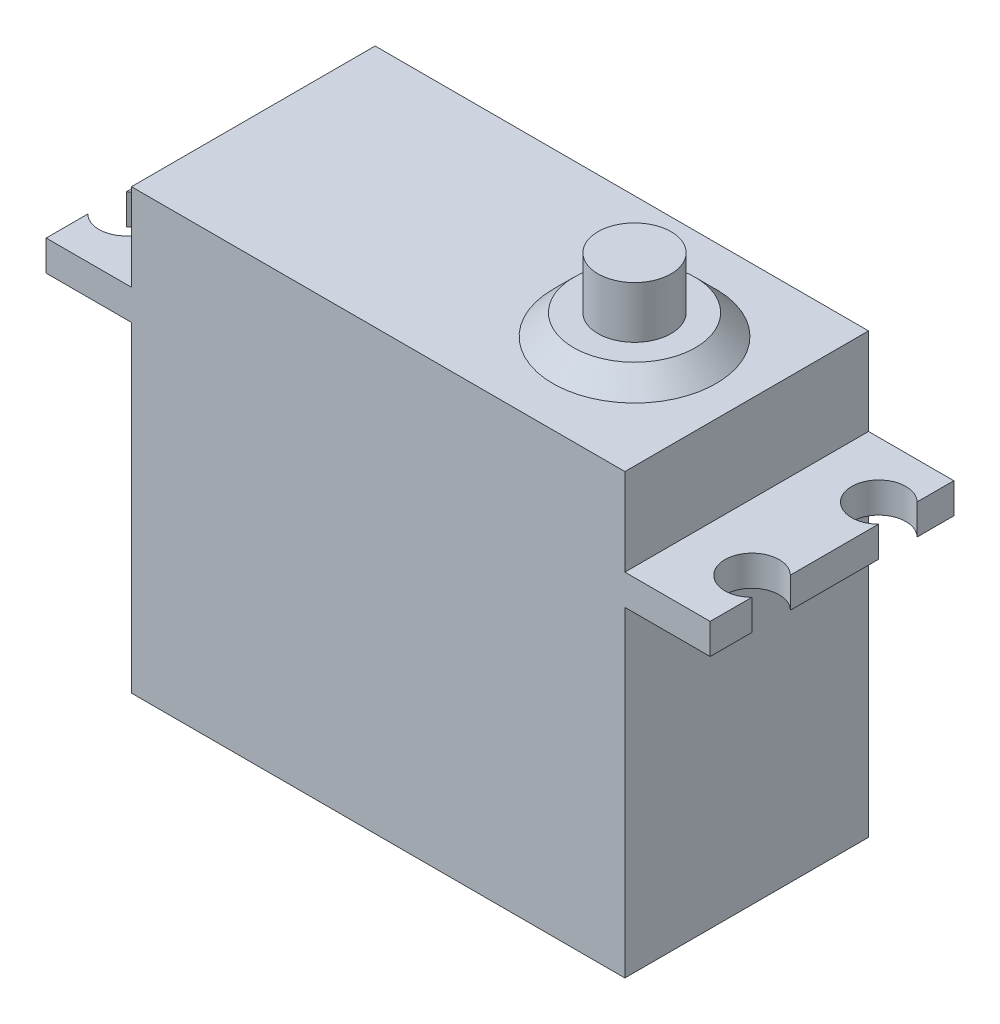
from build123d import *

# Parameters (mm, degrees)
EXTRUDE_1_DEPTH     = 20
SKETCH_2_R          = 2.225
CUT_EXTRUDE_4_DEPTH = 5
SKETCH_3_R          = 2.225
CUT_EXTRUDE_5_DEPTH = 5
SKETCH_4_R          = 5
EXTRUDE_3_DEPTH     = 1.7
CHAMFER_3_SIZE      = 1.7
SKETCH_5_R          = 3
EXTRUDE_4_DEPTH     = 4.25


with BuildPart() as part:
    # 草圖1 → 填料-伸長1 (new body)
    with BuildSketch(Plane.XY):
        Polygon((-4.152823353, 15.901861702), (-4.152823353, -10.448138298), (36.347176647, -10.448138298), (36.347176647, 15.901861702), (43.347176647, 15.901861702), (43.347176647, 18.401861702), (36.347176647, 18.401861702), (36.347176647, 25.551861702), (-4.152823353, 25.551861702), (-4.152823353, 18.401861702), (-11.152823353, 18.401861702), (-11.152823353, 15.901861702), align=None)
    extrude(amount=EXTRUDE_1_DEPTH)

    # 草圖2 → 除料-伸長4 (cut)
    with BuildSketch(Plane(origin=(0, 18.401861702, 0), x_dir=(1, 0, 0), z_dir=(0, 1, 0))):
        with Locations((41.785976647, -4.6)):
            Circle(SKETCH_2_R)
        with Locations((41.785976647, -15)):
            Circle(SKETCH_2_R)
    extrude(amount=-CUT_EXTRUDE_4_DEPTH, mode=Mode.SUBTRACT)

    # 草圖3 → 除料-伸長5 (cut)
    with BuildSketch(Plane(origin=(0, 18.401861702, 0), x_dir=(1, 0, 0), z_dir=(0, 1, 0))):
        with Locations((-9.592823353, -4.6)):
            Circle(SKETCH_3_R)
        with Locations((-9.592823353, -15)):
            Circle(SKETCH_3_R)
    extrude(amount=-CUT_EXTRUDE_5_DEPTH, mode=Mode.SUBTRACT)

    # 草圖4 → 填料-伸長3 (add)
    with BuildSketch(Plane(origin=(0, 25.551861702, 0), x_dir=(1, 0, 0), z_dir=(0, 1, 0))):
        with Locations(Location((27.139664618, -10, 0), (0, 0, 180))):
            Circle(SKETCH_4_R)
    extrude(amount=EXTRUDE_3_DEPTH)

    # 導角3
    chamfer_3_edges = [part.edges().sort_by_distance(p)[0] for p in [
        (32.139664618, 25.551861702, 10),
    ]]
    chamfer(chamfer_3_edges, length=CHAMFER_3_SIZE - 0.0001)  # a hair under: the kernel refuses the full size

    # 草圖5 → 填料-伸長4 (add)
    with BuildSketch(Plane(origin=(0, 27.251861702, 0), x_dir=(1, 0, 0), z_dir=(0, 1, 0))):
        with Locations(Location((27.139664618, -10, 0), (0, 0, 180))):
            Circle(SKETCH_5_R)
    extrude(amount=EXTRUDE_4_DEPTH)


solid = part.part
